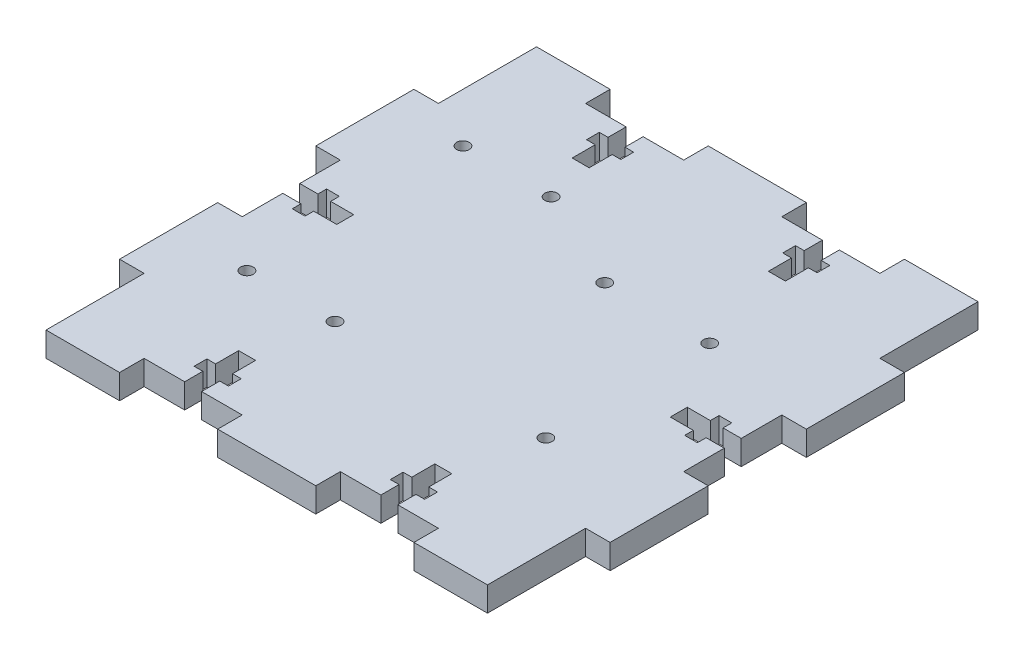
from build123d import *

# Parameters (mm, degrees)
SKETCH1_W                 = 127
SKETCH1_H                 = 127
BOSS_EXTRUDE1_DEPTH       = 6.35
SKETCH2_W                 = 6.35
SKETCH2_H                 = 25.4
CUT_EXTRUDE1_DEPTH        = 6.35
LPATTERN1_COUNT           = 3
LPATTERN1_PITCH           = 50.8
LPATTERN1_COUNT_DIR2      = 2
LPATTERN1_PITCH_DIR2      = 120.65
SKETCH3_W                 = 25.4
SKETCH3_H                 = 6.35
CUT_EXTRUDE2_DEPTH        = 6.35
LPATTERN2_COUNT           = 2
LPATTERN2_PITCH           = 50.8
LPATTERN2_COUNT_DIR2      = 2
LPATTERN2_PITCH_DIR2      = 120.65
SKETCH4_W                 = 13.97
SKETCH4_H                 = 4.3942
SKETCH4_W_2               = 3.302
SKETCH4_H_2               = 8.89
CUT_EXTRUDE3_DEPTH        = 8.89
SKETCH5_W                 = 4.3942
SKETCH5_H                 = 13.97
SKETCH5_W_2               = 8.89
SKETCH5_H_2               = 3.302
CUT_EXTRUDE4_DEPTH        = 30.48
MIRROR3_COPY_1_SKETCH_W   = 4.3942
MIRROR3_COPY_1_SKETCH_H   = 13.97
MIRROR3_COPY_1_SKETCH_W_2 = 8.89
MIRROR3_COPY_1_SKETCH_H_2 = 3.302
MIRROR3_COPY_1_DEPTH      = 30.48
MIRROR3_COPY_2_SKETCH_W   = 4.3942
MIRROR3_COPY_2_SKETCH_H   = 13.97
MIRROR3_COPY_2_SKETCH_W_2 = 8.89
MIRROR3_COPY_2_SKETCH_H_2 = 3.302
MIRROR3_COPY_2_DEPTH      = 30.48
F_4_CLEARANCE_HOLE2_D     = 3.2639
F_4_CLEARANCE_HOLE2_DEPTH = 10.16
F_4_CLEARANCE_HOLE2_TIP   = 0.980574487
F_4_CLEARANCE_HOLE3_D     = 3.2639
F_4_CLEARANCE_HOLE3_DEPTH = 10.16
F_4_CLEARANCE_HOLE3_TIP   = 0.980574487


with BuildPart() as part:
    # Sketch1 → Boss-Extrude1 (new body)
    with BuildSketch(Plane(origin=(0, 0, 0), x_dir=(1, 0, 0), z_dir=(0, 1, 0))):
        with Locations((63.5, 63.5)):
            Rectangle(SKETCH1_W, SKETCH1_H)
    extrude(amount=BOSS_EXTRUDE1_DEPTH)

    # Sketch2 → Cut-Extrude1 (cut)
    with BuildSketch(Plane(origin=(0, 6.35, 0), x_dir=(1, 0, 0), z_dir=(0, 1, 0))):
        with Locations((3.175, 114.3)):
            Rectangle(SKETCH2_W, SKETCH2_H)
    cut_extrude1 = extrude(amount=-CUT_EXTRUDE1_DEPTH, mode=Mode.SUBTRACT)

    # LPattern1: Cut-Extrude1 3 × 2
    with Locations(*[(j * LPATTERN1_PITCH_DIR2, 0, i * LPATTERN1_PITCH) for i in range(LPATTERN1_COUNT) for j in range(LPATTERN1_COUNT_DIR2) if (i, j) != (0, 0)]):
        add(cut_extrude1, mode=Mode.SUBTRACT)

    # Sketch3 → Cut-Extrude2 (cut)
    with BuildSketch(Plane(origin=(0, 6.35, 0), x_dir=(1, 0, 0), z_dir=(0, 1, 0))):
        with Locations((38.1, 3.175)):
            Rectangle(SKETCH3_W, SKETCH3_H)
    cut_extrude2 = extrude(amount=-CUT_EXTRUDE2_DEPTH, mode=Mode.SUBTRACT)

    # LPattern2: Cut-Extrude2 2 × 2
    with Locations(*[(i * LPATTERN2_PITCH, 0, -j * LPATTERN2_PITCH_DIR2) for i in range(LPATTERN2_COUNT) for j in range(LPATTERN2_COUNT_DIR2) if (i, j) != (0, 0)]):
        add(cut_extrude2, mode=Mode.SUBTRACT)

    # Sketch4 → Cut-Extrude3 (cut)
    with BuildSketch(Plane(origin=(0, 6.35, 0), x_dir=(1, 0, 0), z_dir=(0, 1, 0))):
        with Locations((113.665, 63.5)):
            Rectangle(SKETCH4_W, SKETCH4_H)
        with Locations((114.3, 63.5)):
            Rectangle(SKETCH4_W_2, SKETCH4_H_2)
    cut_extrude3 = extrude(amount=-CUT_EXTRUDE3_DEPTH, mode=Mode.SUBTRACT)

    # Mirror1: Cut-Extrude3 across plane
    add(cut_extrude3.mirror(Plane(origin=(63.5, 0, 0), x_dir=(0, 0, 1), z_dir=(1, 0, 0))), mode=Mode.SUBTRACT)

    # Sketch5 → Cut-Extrude4 (cut)
    with BuildSketch(Plane(origin=(0, 6.35, 0), x_dir=(1, 0, 0), z_dir=(0, 1, 0))):
        with Locations((38.1, 13.335)):
            Rectangle(SKETCH5_W, SKETCH5_H)
        with Locations((38.1, 12.7)):
            Rectangle(SKETCH5_W_2, SKETCH5_H_2)
    cut_extrude4 = extrude(amount=-CUT_EXTRUDE4_DEPTH, mode=Mode.SUBTRACT)

    # Mirror2: Cut-Extrude4 across plane
    add(cut_extrude4.mirror(Plane(origin=(63.5, 0, 0), x_dir=(0, 0, 1), z_dir=(1, 0, 0))), mode=Mode.SUBTRACT)

    # Mirror3 copy 1 sketch → Mirror3 copy 1 (cut)
    with BuildSketch(Plane(origin=(127, 6.35, -127), x_dir=(-1, 0, 0), z_dir=(0, 1, 0))):
        with Locations((38.1, 13.335)):
            Rectangle(MIRROR3_COPY_1_SKETCH_W, MIRROR3_COPY_1_SKETCH_H)
        with Locations((38.1, 12.7)):
            Rectangle(MIRROR3_COPY_1_SKETCH_W_2, MIRROR3_COPY_1_SKETCH_H_2)
    extrude(amount=-MIRROR3_COPY_1_DEPTH, mode=Mode.SUBTRACT)

    # Mirror3 copy 2 sketch → Mirror3 copy 2 (cut)
    with BuildSketch(Plane(origin=(0, 6.35, -127), x_dir=(1, 0, 0), z_dir=(0, 1, 0))):
        with Locations((38.1, -13.335)):
            Rectangle(MIRROR3_COPY_2_SKETCH_W, MIRROR3_COPY_2_SKETCH_H)
        with Locations((38.1, -12.7)):
            Rectangle(MIRROR3_COPY_2_SKETCH_W_2, MIRROR3_COPY_2_SKETCH_H_2)
    extrude(amount=-MIRROR3_COPY_2_DEPTH, mode=Mode.SUBTRACT)

    # #4 Clearance Hole2
    with Locations(Plane(origin=(0, 6.35, 0), x_dir=(1, 0, 0), z_dir=(0, 1, 0))):
        with Locations((19.05, 95.25), (41.8592, 95.25), (41.8592, 39.3192), (19.05, 39.3192)):
            Hole(F_4_CLEARANCE_HOLE2_D / 2, depth=F_4_CLEARANCE_HOLE2_DEPTH)
            with Locations((0, 0, -(F_4_CLEARANCE_HOLE2_DEPTH + F_4_CLEARANCE_HOLE2_TIP / 2))):  # 118° drill point
                Cone(0, F_4_CLEARANCE_HOLE2_D / 2, F_4_CLEARANCE_HOLE2_TIP, mode=Mode.SUBTRACT)

    # #4 Clearance Hole3
    with Locations(Plane(origin=(0, 6.35, 0), x_dir=(1, 0, 0), z_dir=(0, 1, 0))):
        with Locations((68.072, 82.931), (95.25, 82.931), (95.25, 40.513)):
            Hole(F_4_CLEARANCE_HOLE3_D / 2, depth=F_4_CLEARANCE_HOLE3_DEPTH)
            with Locations((0, 0, -(F_4_CLEARANCE_HOLE3_DEPTH + F_4_CLEARANCE_HOLE3_TIP / 2))):  # 118° drill point
                Cone(0, F_4_CLEARANCE_HOLE3_D / 2, F_4_CLEARANCE_HOLE3_TIP, mode=Mode.SUBTRACT)


solid = part.part
